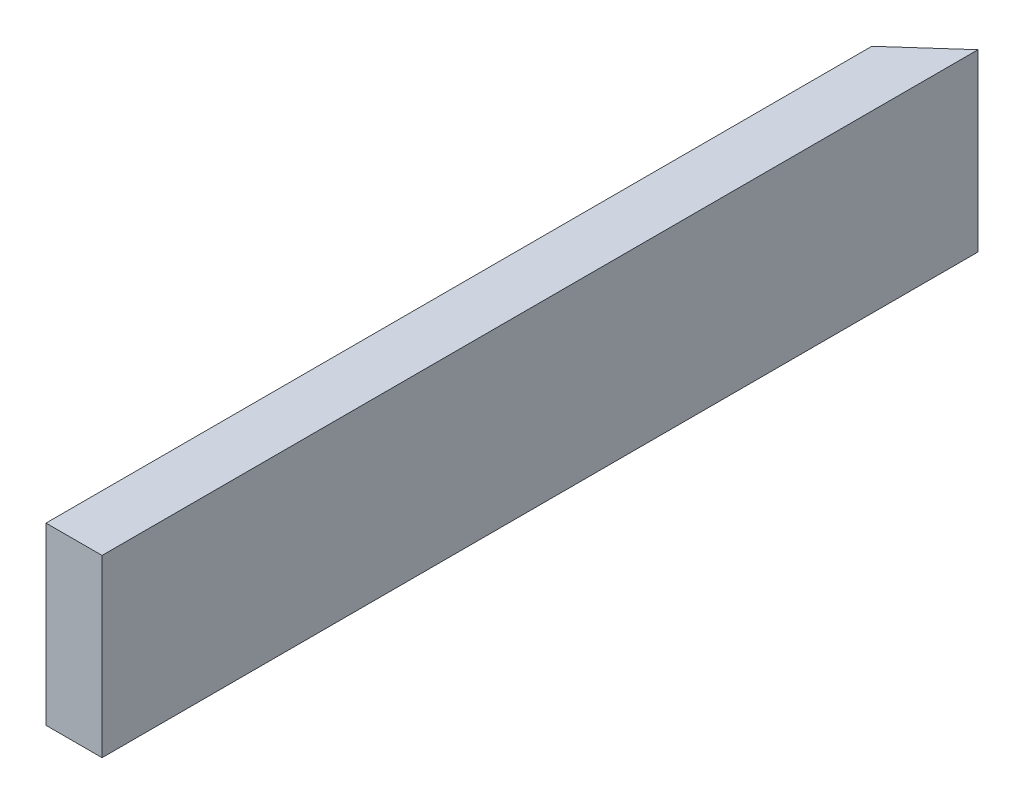
from build123d import *

# Parameters (mm, degrees)
SKETCH1_W           = 3.2
SKETCH1_H           = 10
BOSS_EXTRUDE1_DEPTH = 50
CUT_EXTRUDE1_DEPTH  = 52


with BuildPart() as part:
    # Sketch1 → Boss-Extrude1 (new body)
    with BuildSketch(Plane.XY):
        with Locations((-2.503225806, 7.838709677)):
            Rectangle(SKETCH1_W, SKETCH1_H)
    extrude(amount=BOSS_EXTRUDE1_DEPTH)

    # Sketch3 → Cut-Extrude1 (cut)
    with BuildSketch(Plane(origin=(0, 12.838709677, 0), x_dir=(1, 0, 0), z_dir=(0, 1, 0))):
        Polygon((-0.903225806, 0), (-4.103225806, -2.861130212), (-4.103225806, 0), align=None)
    extrude(amount=-CUT_EXTRUDE1_DEPTH, mode=Mode.SUBTRACT)


solid = part.part
